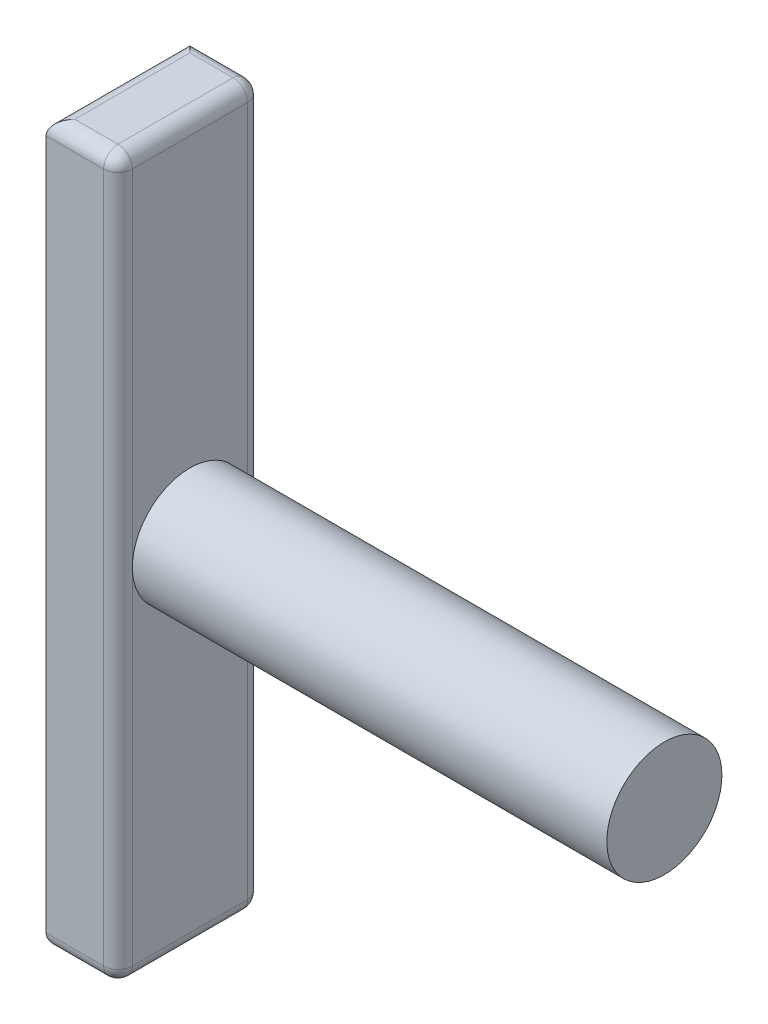
from build123d import *

# Parameters (mm, degrees)
SKETCH1_W           = 100
SKETCH1_H           = 500
BOSS_EXTRUDE1_DEPTH = 50
FILLET1_R           = 10
FILLET2_R           = 10
SKETCH2_R           = 40
BOSS_EXTRUDE2_DEPTH = 330


with BuildPart() as part:
    # Sketch1 → Boss-Extrude1 (new body)
    with BuildSketch(Plane(origin=(0, 0, 0), x_dir=(0, 0, -1), z_dir=(1, 0, 0))):
        with Locations((50, -250)):
            Rectangle(SKETCH1_W, SKETCH1_H)
    extrude(amount=BOSS_EXTRUDE1_DEPTH)

    # Fillet1
    fillet1_edges = [part.edges().sort_by_distance(p)[0] for p in [
        (50, 0, -50),
        (0, 0, -50),
        (0, -500, -50),
        (25, 0, 0),
        (25, 0, -100),
        (25, -500, -100),
        (25, -500, 0),
        (50, -500, -50),
    ]]
    fillet(fillet1_edges, radius=FILLET1_R)

    # Fillet2
    # the kernel refuses this fillet: 10 mm, written as the material it takes off along each edge
    with BuildSketch(Plane(origin=(40, -10, -10), x_dir=(0, 0, 1), z_dir=(1, 0, 0))) as fillet2_piece_1_section:
        Polygon((0, 0), (FILLET2_R, 0), (FILLET2_R, -FILLET2_R), (0, -FILLET2_R), align=None)
    fillet2_piece_1 = extrude(amount=FILLET2_R, mode=Mode.PRIVATE)
    fillet2_piece_1 = fillet2_piece_1 - Plane(origin=(40, -10, -10), x_dir=(0, -0.7071067811865475, -0.7071067811865476), z_dir=(1, 0, 0)) * Sphere(FILLET2_R, mode=Mode.PRIVATE)
    add(fillet2_piece_1, mode=Mode.SUBTRACT)
    with BuildSketch(Plane(origin=(40, -10, -90), x_dir=(0, 0, -1), z_dir=(1, 0, 0))) as fillet2_piece_2_section:
        Polygon((0, 0), (FILLET2_R, 0), (FILLET2_R, FILLET2_R), (0, FILLET2_R), align=None)
    fillet2_piece_2 = extrude(amount=FILLET2_R, mode=Mode.PRIVATE)
    fillet2_piece_2 = fillet2_piece_2 - Plane(origin=(40, -10, -90), x_dir=(0, -0.7071067811865477, 0.7071067811865475), z_dir=(1, 0, 0)) * Sphere(FILLET2_R, mode=Mode.PRIVATE)
    add(fillet2_piece_2, mode=Mode.SUBTRACT)
    with BuildSketch(Plane(origin=(40, -490, -10), x_dir=(0, 0, 1), z_dir=(1, 0, 0))) as fillet2_piece_3_section:
        Polygon((0, 0), (FILLET2_R, 0), (FILLET2_R, FILLET2_R), (0, FILLET2_R), align=None)
    fillet2_piece_3 = extrude(amount=FILLET2_R, mode=Mode.PRIVATE)
    fillet2_piece_3 = fillet2_piece_3 - Plane(origin=(40, -490, -10), x_dir=(0, 0.7071067811865477, -0.7071067811865475), z_dir=(1, 0, 0)) * Sphere(FILLET2_R, mode=Mode.PRIVATE)
    add(fillet2_piece_3, mode=Mode.SUBTRACT)
    with BuildSketch(Plane(origin=(40, -490, -90), x_dir=(0, 0, -1), z_dir=(1, 0, 0))) as fillet2_piece_4_section:
        Polygon((0, 0), (FILLET2_R, 0), (FILLET2_R, -FILLET2_R), (0, -FILLET2_R), align=None)
    fillet2_piece_4 = extrude(amount=FILLET2_R, mode=Mode.PRIVATE)
    fillet2_piece_4 = fillet2_piece_4 - Plane(origin=(40, -490, -90), x_dir=(0, 0.7071067811865475, 0.7071067811865476), z_dir=(1, 0, 0)) * Sphere(FILLET2_R, mode=Mode.PRIVATE)
    add(fillet2_piece_4, mode=Mode.SUBTRACT)
    with BuildSketch(Plane(origin=(50, -10, -100), x_dir=(0, 0, 1), z_dir=(0, -1, 0)), Plane(origin=(50, -490, 0), x_dir=(0, 0, -1), z_dir=(0, 1, 0))) as fillet2_piece_5:
        with BuildLine():
            CenterArc((FILLET2_R, FILLET2_R), FILLET2_R, 180, 90)
            Line((0, FILLET2_R), (0, 0))
            Line((0, 0), (FILLET2_R, 0))
        make_face()
    extrude(amount=480, mode=Mode.SUBTRACT)

    # Sketch2 → Boss-Extrude2 (add)
    with BuildSketch(Plane(origin=(50, 0, 0), x_dir=(0, 0, -1), z_dir=(1, 0, 0))):
        with Locations((50, -250)):
            Circle(SKETCH2_R)
    extrude(amount=BOSS_EXTRUDE2_DEPTH)


solid = part.part
